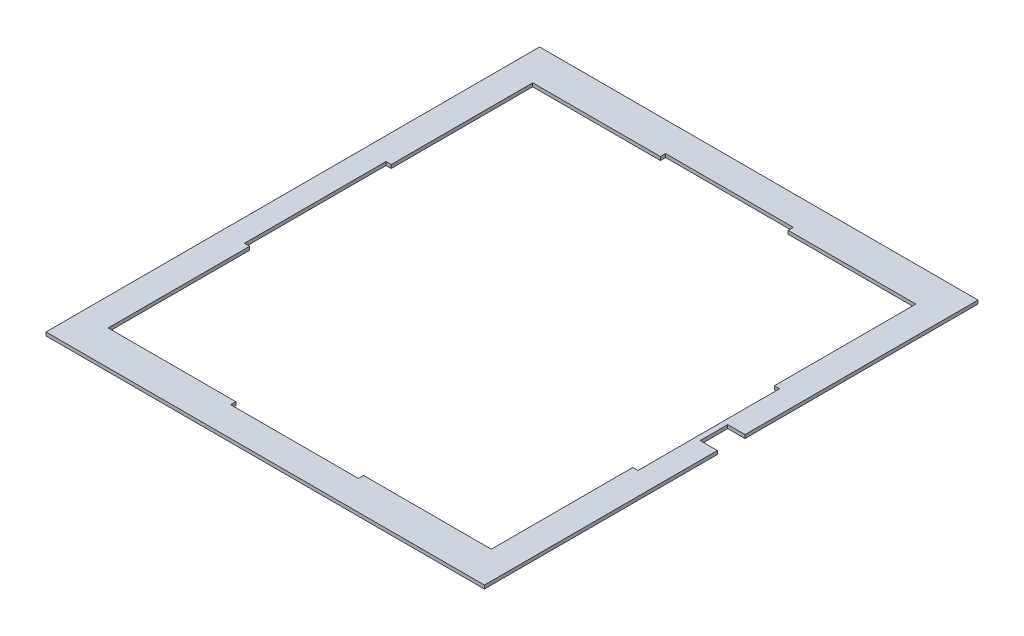
from build123d import *

# Parameters (mm, degrees)
BOSS_EXTRUDE1_DEPTH = 2


with BuildPart() as part:
    # Sketch1 → Boss-Extrude1 (new body)
    with BuildSketch(Plane(origin=(0, 0, 0), x_dir=(1, 0, 0), z_dir=(0, 1, 0))):
        Polygon((-127, -143), (127, -143), (127, -8), (117, -8), (117, 8), (127, 8), (127, 143), (-127, 143), align=None)
        Polygon((37, 123), (111, 123), (111, 41), (114, 41), (114, -41), (111, -41), (111, -123), (37, -123), (37, -126), (-37, -126), (-37, -123), (-111, -123), (-111, -41), (-114, -41), (-114, 41), (-111, 41), (-111, 123), (-37, 123), (-37, 126), (37, 126), align=None, mode=Mode.SUBTRACT)
    extrude(amount=BOSS_EXTRUDE1_DEPTH)


solid = part.part
